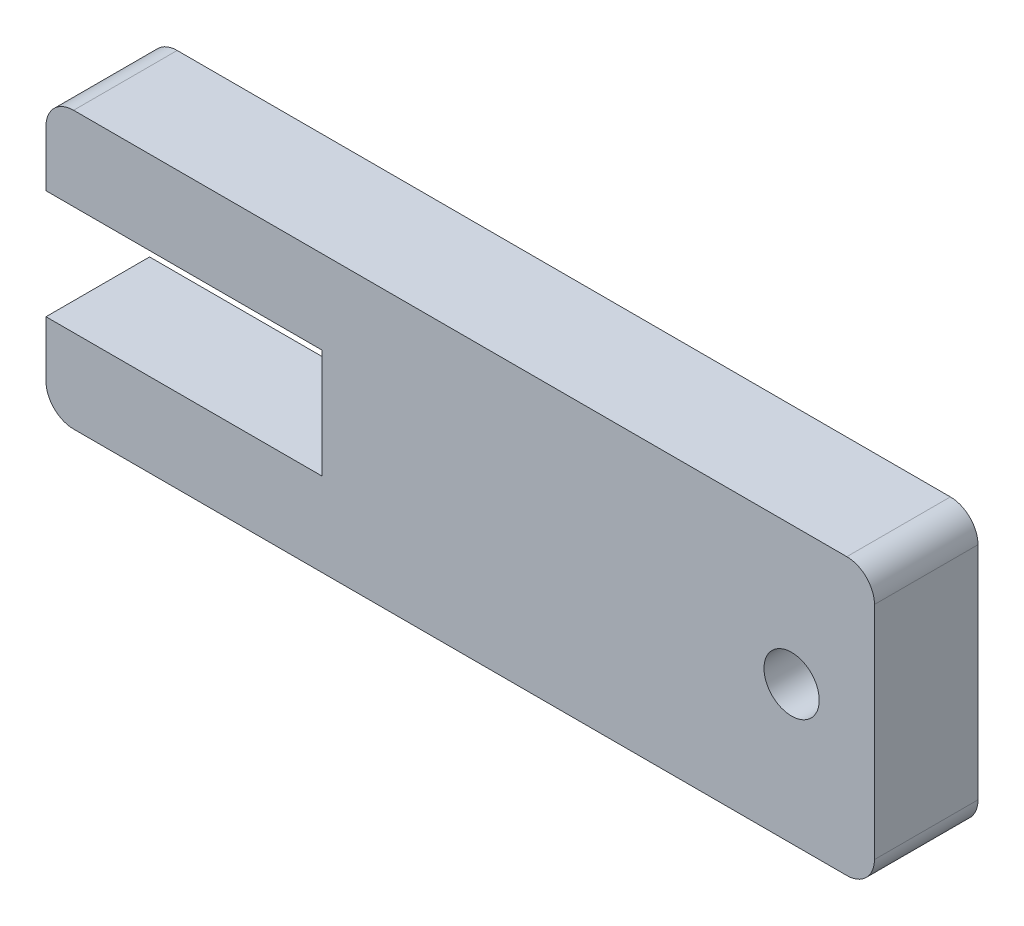
from build123d import *

# Parameters (mm, degrees)
BOSS_EXTRUDE1_DEPTH = 2.38125
FILLET1_R           = 1.27
SKETCH2_R           = 1.27
CUT_EXTRUDE1_DEPTH  = 27.6113492


with BuildPart() as part:
    # Sketch1 → Boss-Extrude1 (new, symmetric)
    with BuildSketch(Plane.XY):
        Polygon((-12.7, 2.50825), (-12.7, 6.35), (25.4, 6.35), (25.4, -6.35), (-12.7, -6.35), (-12.7, -2.50825), (0, -2.50825), (0, 2.50825), align=None)
    extrude(amount=BOSS_EXTRUDE1_DEPTH, both=True)

    # Fillet1
    fillet1_edges = [part.edges().sort_by_distance(p)[0] for p in [
        (-12.7, -6.35, 0),
        (25.4, -6.35, 0),
        (25.4, 6.35, 0),
        (-12.7, 6.35, 0),
    ]]
    fillet(fillet1_edges, radius=FILLET1_R)

    # Sketch2 → Cut-Extrude1 (cut, through all)
    with BuildSketch(Plane.XY.offset(2.38125)):
        with Locations((21.59, 0)):
            Circle(SKETCH2_R)
    extrude(amount=-CUT_EXTRUDE1_DEPTH, mode=Mode.SUBTRACT)


solid = part.part
